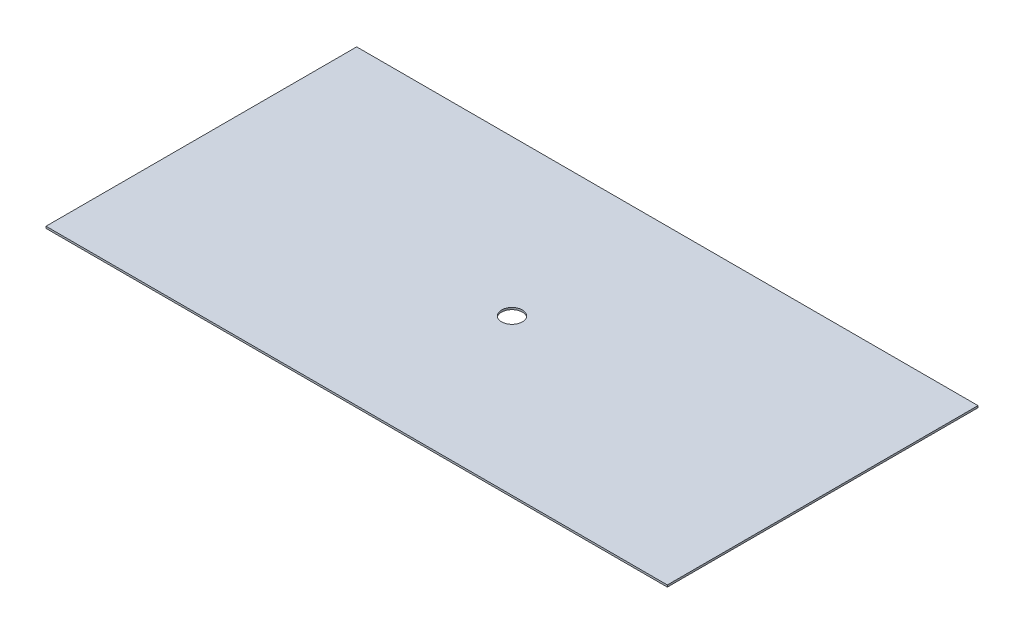
from build123d import *

# Parameters (mm, degrees)
SKETCH1_W                = 240
SKETCH1_H                = 120
BASE_FLANGE1_DEPTH       = 0.7366
F_4_0_4_DIAMETER_HOLE1_D = 8


# Sheet-metal steps are written as plain solids
with BuildPart() as part:
    # Sketch1 → Base-Flange1 (new body)
    with BuildSketch(Plane(origin=(0, 0, 0), x_dir=(1, 0, 0), z_dir=(0, 1, 0))):
        Rectangle(SKETCH1_W, SKETCH1_H)
    extrude(amount=-BASE_FLANGE1_DEPTH)

    # Ø4.0 (4) Diameter Hole1 (through all)
    with Locations(Plane(origin=(0, 0, 0), x_dir=(1, 0, 0), z_dir=(0, 1, 0))):
        with Locations((0, 0)):
            Hole(F_4_0_4_DIAMETER_HOLE1_D / 2)


solid = part.part
